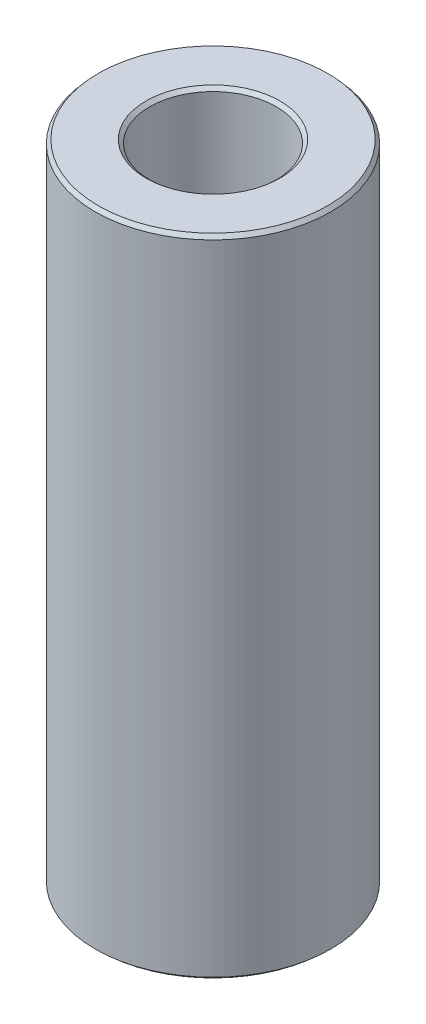
from build123d import *
from OCP.BRepFilletAPI import BRepFilletAPI_MakeChamfer

# Parameters (mm, degrees)
SKETCH1_R           = 10
BOSS_EXTRUDE1_DEPTH = 54.745447022
SKETCH2_R           = 5.373261412
CUT_EXTRUDE1_DEPTH  = 57.542585452
CHAMFER1_SIZE       = 0.308727159
CHAMFER1_SIZE2      = 0.273184243


with BuildPart() as part:
    # Sketch1 → Boss-Extrude1 (new body)
    with BuildSketch(Plane(origin=(0, 0, 0), x_dir=(1, 0, 0), z_dir=(0, 1, 0))):
        Circle(SKETCH1_R)
    extrude(amount=BOSS_EXTRUDE1_DEPTH)

    # Sketch2 → Cut-Extrude1 (cut, through all)
    with BuildSketch(Plane(origin=(0, 0, 0), x_dir=(1, 0, 0), z_dir=(0, 1, 0))):
        Circle(SKETCH2_R)
    extrude(amount=CUT_EXTRUDE1_DEPTH, mode=Mode.SUBTRACT)

    # Chamfer1: one chamfer whose edges measure the first distance from different faces: ONE call of the kernel's chamfer builder (chamfer() names one face for all edges)
    chamfer1_edges_1 = [part.edges().sort_by_distance(p)[0] for p in [
        (-5.373261412, 54.745447022, 0),
    ]]
    chamfer1_side_1 = [part.faces().sort_by_distance(p)[0] for p in [
        (-9.717157288, 54.745447022, 0),
    ]]
    chamfer1_edges_2 = [part.edges().sort_by_distance(p)[0] for p in [
        (-5.373261412, 0, 0),
    ]]
    chamfer1_side_2 = [part.faces().sort_by_distance(p)[0] for p in [
        (-5.373261412, 27.372723511, 0),
    ]]
    chamfer1_edges_3 = [part.edges().sort_by_distance(p)[0] for p in [
        (-10, 0, 0),
    ]]
    chamfer1_side_3 = [part.faces().sort_by_distance(p)[0] for p in [
        (-9.717157288, 0, 0),
    ]]
    chamfer1_edges_4 = [part.edges().sort_by_distance(p)[0] for p in [
        (-10, 54.745447022, 0),
    ]]
    chamfer1_side_4 = [part.faces().sort_by_distance(p)[0] for p in [
        (-10, 27.372723511, 0),
    ]]
    chamfer1 = BRepFilletAPI_MakeChamfer(part.part.solid().wrapped)
    for e in chamfer1_edges_1:
        chamfer1.Add(CHAMFER1_SIZE, CHAMFER1_SIZE2, e.wrapped, chamfer1_side_1[0].wrapped)  # the first distance lies on this face
    for e in chamfer1_edges_2:
        chamfer1.Add(CHAMFER1_SIZE, CHAMFER1_SIZE2, e.wrapped, chamfer1_side_2[0].wrapped)  # the first distance lies on this face
    for e in chamfer1_edges_3:
        chamfer1.Add(CHAMFER1_SIZE, CHAMFER1_SIZE2, e.wrapped, chamfer1_side_3[0].wrapped)  # the first distance lies on this face
    for e in chamfer1_edges_4:
        chamfer1.Add(CHAMFER1_SIZE, CHAMFER1_SIZE2, e.wrapped, chamfer1_side_4[0].wrapped)  # the first distance lies on this face
    add(Compound.cast(chamfer1.Shape()), mode=Mode.REPLACE)


solid = part.part
